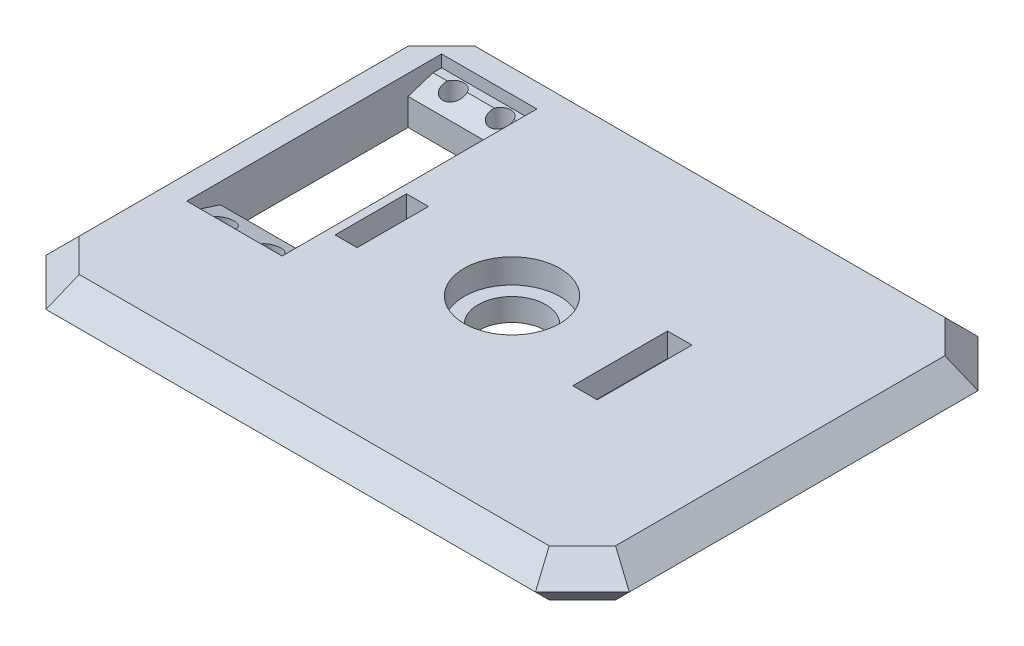
from build123d import *

# Parameters (mm, degrees)
BASE_R                                     = 100
BASE_CIRCLE_DEPTH                          = 10
VERT_START                                 = 5
CUTOUT_W                                   = 4.6
CUTOUT_H                                   = 20
CUTOUT_W_2                                 = 0.4
CUTOUT_W_3                                 = 4.5
CUTOUT_H_2                                 = 15
VERT_SUPPORT_DEPTH                         = 137.774468788
F_1_START                                  = 23.05
F_1_OFFSET_FOR_VERT_SUPPORT_OUTLINE_W      = 5.1
F_1_OFFSET_FOR_VERT_SUPPORT_OUTLINE_H      = 20.2
F_1_OFFSET_FOR_VERT_SUPPORT_DEPTH          = 5.2
F_1_START_2                                = -30.1
F_1_OFFSET_FOR_VERT_SUPPORT_2_OUTLINE_W    = 5.1
F_1_OFFSET_FOR_VERT_SUPPORT_2_OUTLINE_H    = 15.2
F_1_OFFSET_FOR_VERT_SUPPORT_2_DEPTH        = 4.7
CUTOUT_3_W                                 = 20
CUTOUT_3_H                                 = 40
SERVO_CUTOUT_DEPTH                         = 142.774468788
SKETCH4_W                                  = 20
SKETCH4_H                                  = 54
SERVO_REST_DEPTH                           = 2.4
SERVO_SLANT_1_SIZE                         = 5.3
SERVO_SLANT_1_SIZE2                        = 1.7
SERVO_SLANT_2_SIZE                         = 1.7
SERVO_SLANT_2_SIZE2                        = 5.3
F_15_START                                 = -52.15
F_15_SERVO_PRINT_OFFSET_DEPTH              = 20.3
SKETCH6_R                                  = 2.25
M4_THREAD_CLEARANCE_WIGGLE_ROOM_DEPTH      = 142.774468788
SKETCH6_3_R                                = 3.75
M4_SOCKET_HEAD_CLEARANCE_WIGGLE_ROOM_DEPTH = 2
SKETCH5_R                                  = 10
SKETCH5_R_2                                = 7
CENTRAL_AXLE_HEAD_CUTOUT_DEPTH             = 5
SKETCH5_3_R                                = 7
AXLE_BODY_CUTOUT_DEPTH                     = 142.774468788
F_15_OFFSET_AXLE_BY                        = 0.2
F_15_OFFSET_AXLE_2_BY                      = 0.2
F_15_OFFSET_AXLE_3_BY                      = 0.2
SKETCH8_W                                  = 124.3
SKETCH8_H                                  = 94.3
INTERSECT_TOOL_DEPTH                       = 10
CORNER_CHAMFER_SIZE                        = 10
EDGE_CHAMFER_SIZE                          = 5


# Read off the part's stored shape, not the designer's step: .1 Offset for vert support, .15 Servo Print Offset
with BuildPart() as part:
    # Base → Base Circle (new body)
    with BuildSketch(Plane(origin=(0, 0, 0), x_dir=(1, 0, 0), z_dir=(0, 1, 0))):
        with Locations(Location((0, 0, 0), (0, 0, 270))):
            Circle(BASE_R)
    extrude(amount=BASE_CIRCLE_DEPTH)

    # Cutout → Vert Support (cut, through all)
    with BuildSketch(Plane(origin=(0, 0, 0), x_dir=(1, 0, 0), z_dir=(0, 1, 0)).offset(VERT_START)):
        with Locations((25.45, 0)):
            Rectangle(CUTOUT_W, CUTOUT_H)
        with Locations((27.95, 0)):
            Rectangle(CUTOUT_W_2, CUTOUT_H)
        with Locations((-27.75, 0)):
            Rectangle(CUTOUT_W_3, CUTOUT_H_2)
    extrude(amount=VERT_SUPPORT_DEPTH, mode=Mode.SUBTRACT)

    # .1 Offset for vert support outline → .1 Offset for vert support (cut)
    with BuildSketch(Plane.YZ.offset(F_1_START)):
        with Locations((7.45, 0)):
            Rectangle(F_1_OFFSET_FOR_VERT_SUPPORT_OUTLINE_W, F_1_OFFSET_FOR_VERT_SUPPORT_OUTLINE_H)
    extrude(amount=F_1_OFFSET_FOR_VERT_SUPPORT_DEPTH, mode=Mode.SUBTRACT)

    # 1 Offset for vert support 2 outline → 1 Offset for vert support 2 (cut)
    with BuildSketch(Plane.YZ.offset(F_1_START_2)):
        with Locations((7.45, 0)):
            Rectangle(F_1_OFFSET_FOR_VERT_SUPPORT_2_OUTLINE_W, F_1_OFFSET_FOR_VERT_SUPPORT_2_OUTLINE_H)
    extrude(amount=F_1_OFFSET_FOR_VERT_SUPPORT_2_DEPTH, mode=Mode.SUBTRACT)

    # Cutout<3> → Servo cutout (cut, through all)
    with BuildSketch(Plane(origin=(0, 0, 0), x_dir=(1, 0, 0), z_dir=(0, 1, 0))):
        with Locations((-42, 10)):
            Rectangle(CUTOUT_3_W, CUTOUT_3_H)
    extrude(amount=SERVO_CUTOUT_DEPTH, mode=Mode.SUBTRACT)

    # Sketch4 → Servo rest (cut)
    with BuildSketch(Plane.XZ.offset(-10)):
        with Locations((-42, -10)):
            Rectangle(SKETCH4_W, SKETCH4_H)
    extrude(amount=SERVO_REST_DEPTH, mode=Mode.SUBTRACT)

    # Servo Slant 1
    servo_slant_1_edges = [part.edges().sort_by_distance(p)[0] for p in [
        (-42, 7.6, -30),
    ]]
    servo_slant_1_side = [part.faces().sort_by_distance(p)[0] for p in [
        (-42, 7.6, -33.5),
    ]]
    chamfer(servo_slant_1_edges, length=SERVO_SLANT_1_SIZE, length2=SERVO_SLANT_1_SIZE2, reference=servo_slant_1_side[0])

    # Servo Slant 2
    servo_slant_2_edges = [part.edges().sort_by_distance(p)[0] for p in [
        (-42, 7.6, 10),
    ]]
    servo_slant_2_side = [part.faces().sort_by_distance(p)[0] for p in [
        (-42, 3.8, 10),
    ]]
    chamfer(servo_slant_2_edges, length=SERVO_SLANT_2_SIZE, length2=SERVO_SLANT_2_SIZE2, reference=servo_slant_2_side[0])

    # .15 Servo Print Offset outline → .15 Servo Print Offset (cut)
    with BuildSketch(Plane.YZ.offset(F_15_START)):
        Polygon((10, 17.15), (7.45, 17.15), (7.45, 15.323467766), (5.742472603, 10), (0, 10), (0, -30), (5.742472603, -30), (7.45, -35.323467766), (7.45, -37.15), (10, -37.15), align=None)
    extrude(amount=F_15_SERVO_PRINT_OFFSET_DEPTH, mode=Mode.SUBTRACT)

    # Sketch6 → M4 Thread Clearance + wiggle room (cut, through all)
    with BuildSketch(Plane.XZ):
        with Locations(Location((-47, -34.5, 0), (0, 0, 270))):
            Circle(SKETCH6_R)
        with Locations(Location((-37, -34.5, 0), (0, 0, 270))):
            Circle(SKETCH6_R)
        with Locations(Location((-37, 14.5, 0), (0, 0, 270))):
            Circle(SKETCH6_R)
        with Locations(Location((-47, 14.5, 0), (0, 0, 270))):
            Circle(SKETCH6_R)
    extrude(amount=-M4_THREAD_CLEARANCE_WIGGLE_ROOM_DEPTH, mode=Mode.SUBTRACT)

    # Sketch6<3> → M4 Socket Head Clearance + wiggle room (cut)
    with BuildSketch(Plane.XZ):
        with Locations(Location((-47, -34.5, 0), (0, 0, 270))):
            Circle(SKETCH6_3_R)
        with Locations(Location((-37, -34.5, 0), (0, 0, 270))):
            Circle(SKETCH6_3_R)
        with Locations(Location((-37, 14.5, 0), (0, 0, 270))):
            Circle(SKETCH6_3_R)
        with Locations(Location((-47, 14.5, 0), (0, 0, 270))):
            Circle(SKETCH6_3_R)
    extrude(amount=-M4_SOCKET_HEAD_CLEARANCE_WIGGLE_ROOM_DEPTH, mode=Mode.SUBTRACT)

    # Sketch5 → Central Axle Head cutout (cut)
    with BuildSketch(Plane(origin=(0, 10, 0), x_dir=(1, 0, 0), z_dir=(0, 1, 0))):
        with Locations(Location((0, 0, 0), (0, 0, 270))):
            Circle(SKETCH5_R)
        with Locations(Location((0, 0, 0), (0, 0, 270))):
            Circle(SKETCH5_R_2, mode=Mode.SUBTRACT)
    extrude(amount=-CENTRAL_AXLE_HEAD_CUTOUT_DEPTH, mode=Mode.SUBTRACT)

    # Sketch5<3> → Axle Body cutout (cut, through all)
    with BuildSketch(Plane(origin=(0, 10, 0), x_dir=(1, 0, 0), z_dir=(0, 1, 0))):
        with Locations(Location((0, 0, 0), (0, 0, 270))):
            Circle(SKETCH5_3_R)
    extrude(amount=-AXLE_BODY_CUTOUT_DEPTH, mode=Mode.SUBTRACT)

    # .15 Offset, Axle: a face moved inward by 0.2
    extrude(part.faces().sort_by_distance((0, 5, 8))[0], amount=F_15_OFFSET_AXLE_BY, dir=(0, -1, 0), mode=Mode.SUBTRACT)

    # 15 Offset_ Axle 2: a curved face moved inward by 0.2
    add(Solid.thicken(part.faces().sort_by_distance((0, 2.5, -7))[0], -F_15_OFFSET_AXLE_2_BY), mode=Mode.SUBTRACT)

    # 15 Offset_ Axle 3: a curved face moved inward by 0.2
    add(Solid.thicken(part.faces().sort_by_distance((0, 7.5, -10))[0], -F_15_OFFSET_AXLE_3_BY), mode=Mode.SUBTRACT)


with BuildPart() as body_2:
    # Sketch8 → Intersect Tool (new body)
    with BuildSketch(Plane(origin=(0, 10, 0), x_dir=(1, 0, 0), z_dir=(0, 1, 0))):
        Rectangle(SKETCH8_W, SKETCH8_H)
    extrude(amount=-INTERSECT_TOOL_DEPTH)


with BuildPart() as part_1:
    add(part.part)

    # Intersect with tool: intersect body 2
    add(body_2.part, mode=Mode.INTERSECT)

    # Corner Chamfer
    corner_chamfer_edges = [part_1.edges().sort_by_distance(p)[0] for p in [
        (62.15, 5, -47.15),
        (62.15, 5, 47.15),
        (-62.15, 5, 47.15),
        (-62.15, 5, -47.15),
    ]]
    chamfer(corner_chamfer_edges, length=CORNER_CHAMFER_SIZE)

    # Edge Chamfer
    edge_chamfer_edges = [part_1.edges().sort_by_distance(p)[0] for p in [
        (-57.15, 10, -42.15),
        (0, 10, -47.15),
        (57.15, 10, -42.15),
        (62.15, 10, 0),
        (57.15, 10, 42.15),
        (0, 10, 47.15),
        (-57.15, 10, 42.15),
        (-62.15, 10, 0),
        (-57.15, 0, -42.15),
        (0, 0, -47.15),
        (57.15, 0, -42.15),
        (62.15, 0, 0),
        (57.15, 0, 42.15),
        (-62.15, 0, 0),
        (-57.15, 0, 42.15),
        (0, 0, 47.15),
    ]]
    chamfer(edge_chamfer_edges, length=EDGE_CHAMFER_SIZE - 0.0001)  # a hair under: the kernel refuses the full size


solid = part_1.part
